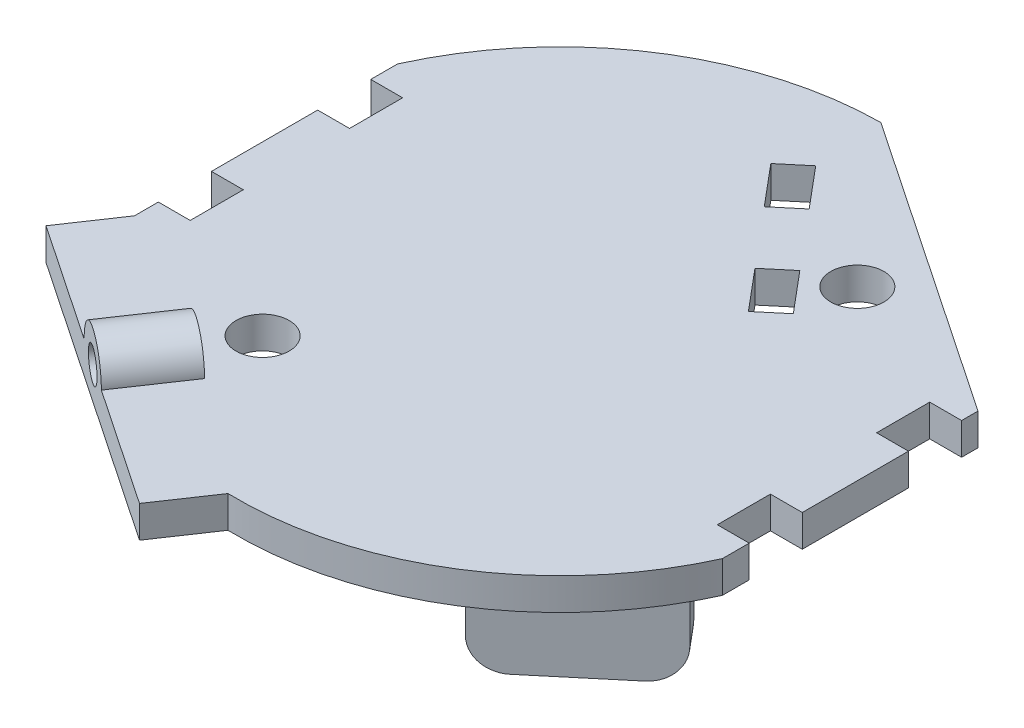
from build123d import *

# Parameters (mm, degrees)
CROQUIS1_R              = 30.5
SALIENTE_EXTRUIR1_DEPTH = 3
CORTAR_EXTRUIR3_START   = -4
CORTAR_EXTRUIR3_DEPTH   = 4
CORTAR_EXTRUIR6_DEPTH   = 10
CROQUIS10_R             = 2.5
CORTAR_EXTRUIR7_DEPTH   = 10
CORTAR_EXTRUIR8_START   = -3
CORTAR_EXTRUIR8_DEPTH   = 3
SALIENTE_EXTRUIR2_DEPTH = 10
REDONDEO1_R             = 3
REDONDEO2_R             = 1
CORTAR_EXTRUIR9_START   = -3
CORTAR_EXTRUIR9_DEPTH   = 3
CORTAR_EXTRUIR10_DEPTH  = 10
CROQUIS16_W             = 32.622025527
CROQUIS16_H             = 3
SALIENTE_EXTRUIR3_DEPTH = 6
CROQUIS17_R             = 3
SALIENTE_EXTRUIR4_DEPTH = 7
CROQUIS18_R             = 1.5
CORTAR_EXTRUIR11_DEPTH  = 6


with BuildPart() as part:
    # Croquis1 → Saliente-Extruir1 (new body)
    with BuildSketch(Plane(origin=(0, 0, 0), x_dir=(1, 0, 0), z_dir=(0, 1, 0))):
        Circle(CROQUIS1_R)
    extrude(amount=SALIENTE_EXTRUIR1_DEPTH)

    # Croquis5 → Cortar-Extruir3 (cut)
    with BuildSketch(Plane(origin=(0, 3, 0), x_dir=(1, 0, 0), z_dir=(0, 1, 0)).offset(CORTAR_EXTRUIR3_START)):
        with BuildLine():
            Line((30.087372767, -5), (24.814059068, -5))
            Line((24.814059068, -5), (24.814059068, -10))
            Line((24.814059068, -10), (28.814059068, -10))
            ThreePointArc((28.814059068, -10), (29.556634924, -7.526973624), (30.087372767, -5))
        make_face()
        with BuildLine():
            Line((24.814059068, 5), (30.087372767, 5))
            ThreePointArc((30.087372767, 5), (29.556634924, 7.526973624), (28.814059068, 10))
            Line((28.814059068, 10), (24.814059068, 10))
            Line((24.814059068, 10), (24.814059068, 5))
        make_face()
        with BuildLine():
            ThreePointArc((-30.087372767, -5), (-29.556634924, -7.526973624), (-28.814059068, -10))
            Line((-28.814059068, -10), (-24.814059068, -10))
            Line((-24.814059068, -10), (-24.814059068, -5))
            Line((-24.814059068, -5), (-30.087372767, -5))
        make_face()
        with BuildLine():
            Line((-24.814059068, 10), (-28.814059068, 10))
            ThreePointArc((-28.814059068, 10), (-29.556634924, 7.526973624), (-30.087372767, 5))
            Line((-30.087372767, 5), (-24.814059068, 5))
            Line((-24.814059068, 5), (-24.814059068, 10))
        make_face()
    extrude(amount=CORTAR_EXTRUIR3_DEPTH, mode=Mode.SUBTRACT)

    # Croquis9 → Cortar-Extruir6 (cut)
    with BuildSketch(Plane(origin=(0, 3, 0), x_dir=(1, 0, 0), z_dir=(0, 1, 0))):
        Polygon((7.971418181, 14.613753061), (5.673284852, 12.685390231), (8.887222901, 8.855168016), (11.18535623, 10.783530845), align=None)
        Polygon((0.177618414, 23.902041933), (-2.120514915, 21.973679104), (1.093423133, 18.143456889), (3.391556462, 20.071819718), align=None)
    extrude(amount=-CORTAR_EXTRUIR6_DEPTH, mode=Mode.SUBTRACT)

    # Croquis10 → Cortar-Extruir7 (cut)
    with BuildSketch(Plane(origin=(0, 3, 0), x_dir=(1, 0, 0), z_dir=(0, 1, 0))):
        with Locations((12, 16)):
            Circle(CROQUIS10_R)
        with Locations((-12, -16)):
            Circle(CROQUIS10_R)
    extrude(amount=-CORTAR_EXTRUIR7_DEPTH, mode=Mode.SUBTRACT)

    # Croquis11 → Cortar-Extruir8 (cut)
    with BuildSketch(Plane(origin=(0, 3, 0), x_dir=(1, 0, 0), z_dir=(0, 1, 0)).offset(CORTAR_EXTRUIR8_START)):
        with BuildLine():
            Line((30.087372767, 5), (27.814059068, 5))
            Line((27.814059068, 5), (27.814059068, -5))
            Line((27.814059068, -5), (30.087372767, -5))
            ThreePointArc((30.087372767, -5), (30.5, 0), (30.087372767, 5))
        make_face()
        with BuildLine():
            Line((-27.814059068, -5), (-27.814059068, 5))
            Line((-27.814059068, 5), (-30.087372767, 5))
            ThreePointArc((-30.087372767, 5), (-30.5, 0), (-30.087372767, -5))
            Line((-30.087372767, -5), (-27.814059068, -5))
        make_face()
        with BuildLine():
            Line((27.814059068, 12.515115586), (27.814059068, 10))
            Line((27.814059068, 10), (28.814059068, 10))
            ThreePointArc((28.814059068, 10), (28.341972277, 11.268655974), (27.814059068, 12.515115586))
        make_face()
        with BuildLine():
            Line((-27.814059068, 10), (-27.814059068, 12.515115586))
            ThreePointArc((-27.814059068, 12.515115586), (-28.341972277, 11.268655974), (-28.814059068, 10))
            Line((-28.814059068, 10), (-27.814059068, 10))
        make_face()
        with BuildLine():
            ThreePointArc((-28.814059068, -10), (-28.341972277, -11.268655974), (-27.814059068, -12.515115586))
            Line((-27.814059068, -12.515115586), (-27.814059068, -10))
            Line((-27.814059068, -10), (-28.814059068, -10))
        make_face()
        with BuildLine():
            Line((28.814059068, -10), (27.814059068, -10))
            Line((27.814059068, -10), (27.814059068, -12.515115586))
            ThreePointArc((27.814059068, -12.515115586), (28.341972277, -11.268655974), (28.814059068, -10))
        make_face()
    extrude(amount=CORTAR_EXTRUIR8_DEPTH, mode=Mode.SUBTRACT)

    # Croquis13 → Saliente-Extruir2 (add)
    with BuildSketch(Plane.XZ):
        Polygon((-6.816688183, 4.321977983), (-19.672440377, -10.99891088), (-17.374307048, -12.927273709), (-4.518554854, 2.393615154), align=None)
        Polygon((21.527275636, 8.931176939), (23.455638465, 11.229310268), (11.964971818, 20.871124414), (10.036608989, 18.572991084), align=None)
    extrude(amount=SALIENTE_EXTRUIR2_DEPTH)

    # Redondeo1
    redondeo1_edges = [part.edges().sort_by_distance(p)[0] for p in [
        (11.000790403, -10, 19.722057749),
        (22.49145705, -10, 10.080243604),
        (-5.667621519, -10, 3.357796568),
        (-18.523373712, -10, -11.963092294),
    ]]
    fillet(redondeo1_edges, radius=REDONDEO1_R)

    # Redondeo2
    redondeo2_edges = [part.edges().sort_by_distance(p)[0] for p in [
        (17.710305141, 0, 16.050217341),
        (11.000790403, 0, 19.722057749),
        (-5.667621519, 0, 3.357796568),
        (-13.24456428, 0, -3.338466449),
        (22.49145705, 0, 10.080243604),
        (-18.523373712, 0, -11.963092294),
    ]]
    fillet(redondeo2_edges, radius=REDONDEO2_R)

    # Croquis14 → Cortar-Extruir9 (cut)
    with BuildSketch(Plane(origin=(0, 3, 0), x_dir=(1, 0, 0), z_dir=(0, 1, 0)).offset(CORTAR_EXTRUIR9_START)):
        with BuildLine():
            Line((-0.28585192, 30.498660441), (27.814059068, 11.545031156))
            Line((27.814059068, 11.545031156), (27.814059068, 12.515115586))
            ThreePointArc((27.814059068, 12.515115586), (16.440879495, 25.689442995), (-0.28585192, 30.498660441))
        make_face()
    extrude(amount=CORTAR_EXTRUIR9_DEPTH, mode=Mode.SUBTRACT)

    # Croquis15 → Cortar-Extruir10 (cut)
    with BuildSketch(Plane(origin=(0, 3, 0), x_dir=(1, 0, 0), z_dir=(0, 1, 0))):
        with BuildLine():
            ThreePointArc((-27.814059068, -12.515115586), (-16.818755005, -25.476887966), (-0.611063758, -30.596946471))
            Line((-0.611063758, -30.596946471), (-27.814059068, -12.24829445))
            Line((-27.814059068, -12.24829445), (-27.814059068, -12.515115586))
        make_face()
    extrude(amount=-CORTAR_EXTRUIR10_DEPTH, mode=Mode.SUBTRACT)


with BuildPart() as cortar_extruir10_kept_piece:
    # of the separate pieces the step leaves, the one the design keeps (cortar_extruir10_pieces_kept)
    add(part.part.solids().sort_by_distance((10.036608989, -1, 18.572991084))[0])

    # Croquis16 → Saliente-Extruir3 (add)
    with BuildSketch(Plane(origin=(-14.375575006, 0, 21.312666404), x_dir=(0.8290375725550415, 0, 0.5591929034707471), z_dir=(-0.5591929034707471, 0, 0.8290375725550415))):
        with Locations((0.101272086, 1.5)):
            Rectangle(CROQUIS16_W, CROQUIS16_H)
    extrude(amount=SALIENTE_EXTRUIR3_DEPTH)

    # Croquis17 → Saliente-Extruir4 (add)
    with BuildSketch(Plane(origin=(-17.730732427, 0, 26.286891839), x_dir=(0.8290375725550415, 0, 0.5591929034707471), z_dir=(-0.5591929034707471, 0, 0.8290375725550415))):
        with Locations((0.101272087, 3)):
            Circle(CROQUIS17_R)
    extrude(amount=-SALIENTE_EXTRUIR4_DEPTH)

    # Croquis18 → Cortar-Extruir11 (cut)
    with BuildSketch(Plane(origin=(-17.730732427, 0, 26.286891839), x_dir=(0.8290375725550415, 0, 0.5591929034707471), z_dir=(-0.5591929034707471, 0, 0.8290375725550415))):
        with Locations((0.101272087, 3)):
            Circle(CROQUIS18_R)
    extrude(amount=-CORTAR_EXTRUIR11_DEPTH, mode=Mode.SUBTRACT)


solid = cortar_extruir10_kept_piece.part
